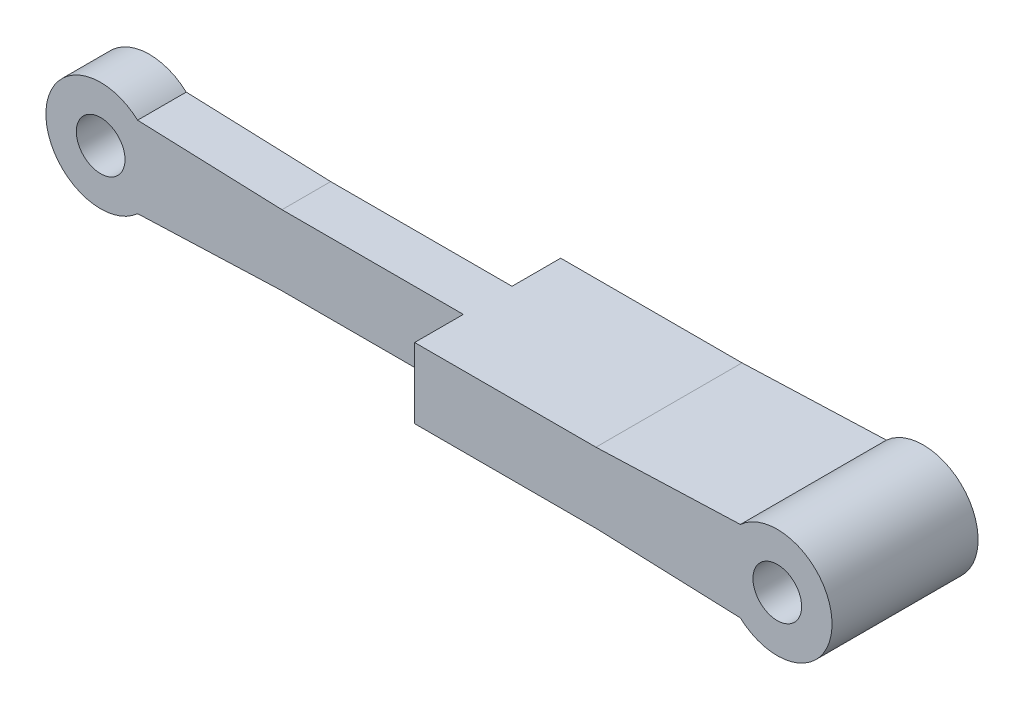
from build123d import *

# Parameters (mm, degrees)
SKETCH1_R              = 22.5
SKETCH1_R_2            = 10
BOSS_EXTRUDE1_DEPTH    = 60
CUT_EXTRUDE1_START     = -36.947990214
CUT_EXTRUDE1_OUTLINE_W = 173
CUT_EXTRUDE1_OUTLINE_H = 20
CUT_EXTRUDE1_DEPTH     = 45


# Read off the part's stored shape, not the designer's step: Cut-Extrude1
with BuildPart() as part:
    # Sketch1 → Boss-Extrude1 (new body)
    # profile 1 of 3: a face of its own
    with BuildSketch(Plane.XY):
        with Locations((-148.967401035, 0)):
            Circle(SKETCH1_R)
        with Locations((-148.967401035, 0)):
            Circle(SKETCH1_R_2, mode=Mode.SUBTRACT)
    # profile 2 of 3: a face of its own
    with BuildSketch(Plane.XY):
        with BuildLine():
            Line((-133.805803377, -16.624558835), (-75.213723302, -14.429535265))
            Line((-75.213723302, -14.429535265), (0, -14.429535265))
            Line((0, -14.429535265), (75.213723302, -14.429535265))
            Line((75.213723302, -14.429535265), (133.805803377, -16.624558835))
            ThreePointArc((133.805803377, -16.624558835), (126.467401035, 0), (133.805803377, 16.624558835))
            Line((133.805803377, 16.624558835), (74.483700517, 14.447990214))
            Line((74.483700517, 14.447990214), (0, 14.447990214))
            Line((0, 14.447990214), (-74.483700517, 14.447990214))
            Line((-74.483700517, 14.447990214), (-133.805803377, 16.624558835))
            ThreePointArc((-133.805803377, 16.624558835), (-128.383597362, 9.086089717), (-126.467401035, 0))
            ThreePointArc((-126.467401035, 0), (-128.383597362, -9.086089717), (-133.805803377, -16.624558835))
        make_face()
    # profile 3 of 3: a face of its own
    with BuildSketch(Plane.XY):
        with Locations((148.967401035, 0)):
            Circle(SKETCH1_R)
        with Locations((148.967401035, 0)):
            Circle(SKETCH1_R_2, mode=Mode.SUBTRACT)
    extrude(amount=BOSS_EXTRUDE1_DEPTH)

    # Cut-Extrude1 outline → Cut-Extrude1 (cut)
    with BuildSketch(Plane(origin=(0, 14.447990214, 0), x_dir=(1, 0, 0), z_dir=(0, 1, 0)).offset(CUT_EXTRUDE1_START)):
        with Locations((-86.5, -10)):
            Rectangle(CUT_EXTRUDE1_OUTLINE_W, CUT_EXTRUDE1_OUTLINE_H)
        with Locations((-86.5, -50)):
            Rectangle(CUT_EXTRUDE1_OUTLINE_W, CUT_EXTRUDE1_OUTLINE_H)
    extrude(amount=CUT_EXTRUDE1_DEPTH, mode=Mode.SUBTRACT)


solid = part.part
